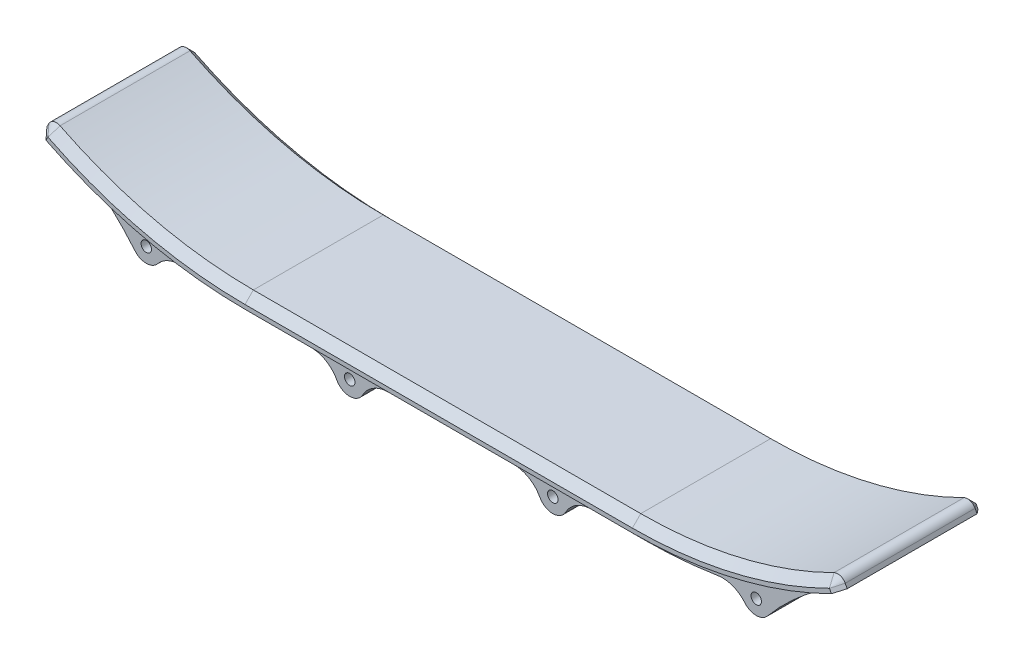
from build123d import *

# Parameters (mm, degrees)
SKETCH_1_R           = 1.25
EXTRUDE_1_DEPTH      = 29
EXTRUDE_2_DEPTH      = 3
EXTRUDE_2_DEPTH_BACK = 32
CHAMFER_1_SIZE       = 2


with BuildPart() as part:
    # 草图1 → 凸台-拉伸1 (new body)
    with BuildSketch(Plane.XY):
        with BuildLine():
            Line((-71.271215686, 33), (-163.728784314, 33))
            ThreePointArc((-163.728784314, 33), (-187.426920576, 35.752824596), (-209.86299145, 43.864694254))
            ThreePointArc((-209.86299145, 43.864694254), (-211.371961919, 43.977504611), (-212.528051157, 43.001197422))
            Line((-212.528051157, 43.001197422), (-213, 42.09809972))
            ThreePointArc((-213, 42.09809972), (-202.192009237, 35.020119991), (-192.973824319, 25.968295413))
            ThreePointArc((-192.973824319, 25.968295413), (-190.288164523, 24.71302347), (-187.602714776, 25.968744715))
            ThreePointArc((-187.602714776, 25.968744715), (-184.680917301, 28.037551849), (-181.118358374, 28.391158027))
            ThreePointArc((-181.118358374, 28.391158027), (-172.451349972, 27.34834419), (-163.728784314, 27))
            Line((-163.728784314, 27), (-150.96187697, 27))
            ThreePointArc((-150.96187697, 27), (-147.37951276, 26.013872851), (-144.806481866, 23.333333333))
            ThreePointArc((-144.806481866, 23.333333333), (-141.728784314, 21.5), (-138.651086762, 23.333333333))
            ThreePointArc((-138.651086762, 23.333333333), (-136.078055868, 26.013872851), (-132.495691658, 27))
            Line((-132.495691658, 27), (-102.504308342, 27))
            ThreePointArc((-102.504308342, 27), (-98.921944132, 26.013872851), (-96.348913238, 23.333333333))
            ThreePointArc((-96.348913238, 23.333333333), (-93.271215686, 21.5), (-90.193518134, 23.333333333))
            ThreePointArc((-90.193518134, 23.333333333), (-87.62048724, 26.013872851), (-84.03812303, 27))
            Line((-84.03812303, 27), (-71.271215686, 27))
            ThreePointArc((-71.271215686, 27), (-62.548650028, 27.34834419), (-53.881641626, 28.391158027))
            ThreePointArc((-53.881641626, 28.391158027), (-50.319082699, 28.037551849), (-47.397285224, 25.968744715))
            ThreePointArc((-47.397285224, 25.968744715), (-44.711835477, 24.71302347), (-42.026175681, 25.968295413))
            ThreePointArc((-42.026175681, 25.968295413), (-32.807990763, 35.020119991), (-22, 42.09809972))
            Line((-22, 42.09809972), (-22.471948843, 43.001197422))
            ThreePointArc((-22.471948843, 43.001197422), (-23.628038081, 43.977504611), (-25.13700855, 43.864694254))
            ThreePointArc((-25.13700855, 43.864694254), (-47.573079424, 35.752824596), (-71.271215686, 33))
        make_face()
        with Locations(Location((-44.711542697, 28.213023457, 0), (0, 0, 180))):
            Circle(SKETCH_1_R, mode=Mode.SUBTRACT)
        with Locations(Location((-93.271215686, 25, 0), (0, 0, 180))):
            Circle(SKETCH_1_R, mode=Mode.SUBTRACT)
        with Locations(Location((-141.728784314, 25, 0), (0, 0, 180))):
            Circle(SKETCH_1_R, mode=Mode.SUBTRACT)
        with Locations(Location((-190.288457303, 28.213023457, 0), (0, 0, 180))):
            Circle(SKETCH_1_R, mode=Mode.SUBTRACT)
    extrude(amount=EXTRUDE_1_DEPTH)

    # 草图2 → 凸台-拉伸2 (add, two sides: drawn at the far end of the back side and taken through both)
    with BuildSketch(Plane(origin=(0, 0, 0), x_dir=(-1, 0, 0), z_dir=(0, 0, -1)).offset(-EXTRUDE_2_DEPTH_BACK)):
        with BuildLine():
            Line((163.728784314, 30), (71.271215686, 30))
            ThreePointArc((71.271215686, 30), (45.903831548, 33.068787794), (22, 42.09809972))
            Line((22, 42.09809972), (22.471948843, 43.001197422))
            ThreePointArc((22.471948843, 43.001197422), (23.628038081, 43.977504611), (25.13700855, 43.864694254))
            ThreePointArc((25.13700855, 43.864694254), (47.573079424, 35.752824596), (71.271215686, 33))
            Line((71.271215686, 33), (163.728784314, 33))
            ThreePointArc((163.728784314, 33), (187.426920576, 35.752824596), (209.86299145, 43.864694254))
            ThreePointArc((209.86299145, 43.864694254), (211.371961919, 43.977504611), (212.528051157, 43.001197422))
            Line((212.528051157, 43.001197422), (213, 42.09809972))
            ThreePointArc((213, 42.09809972), (189.096168452, 33.068787794), (163.728784314, 30))
        make_face()
    extrude(amount=EXTRUDE_2_DEPTH + EXTRUDE_2_DEPTH_BACK)

    # 倒角1
    chamfer_1_edges = [part.edges().sort_by_distance(p)[0] for p in [
        (-22.235974422, 42.549648571, 32),
        (-23.628038081, 43.977504611, 32),
        (-47.573079424, 35.752824596, 32),
        (-117.5, 33, 32),
        (-187.426920576, 35.752824596, 32),
        (-211.371961919, 43.977504611, 32),
        (-212.764025578, 42.549648571, 32),
        (-212.764025578, 42.549648571, -3),
        (-211.371961919, 43.977504611, -3),
        (-187.426920576, 35.752824596, -3),
        (-117.5, 33, -3),
        (-47.573079424, 35.752824596, -3),
        (-23.628038081, 43.977504611, -3),
        (-22.235974422, 42.549648571, -3),
    ]]
    chamfer(chamfer_1_edges, length=CHAMFER_1_SIZE - 0.0001)  # a hair under: the kernel refuses the full size


solid = part.part
